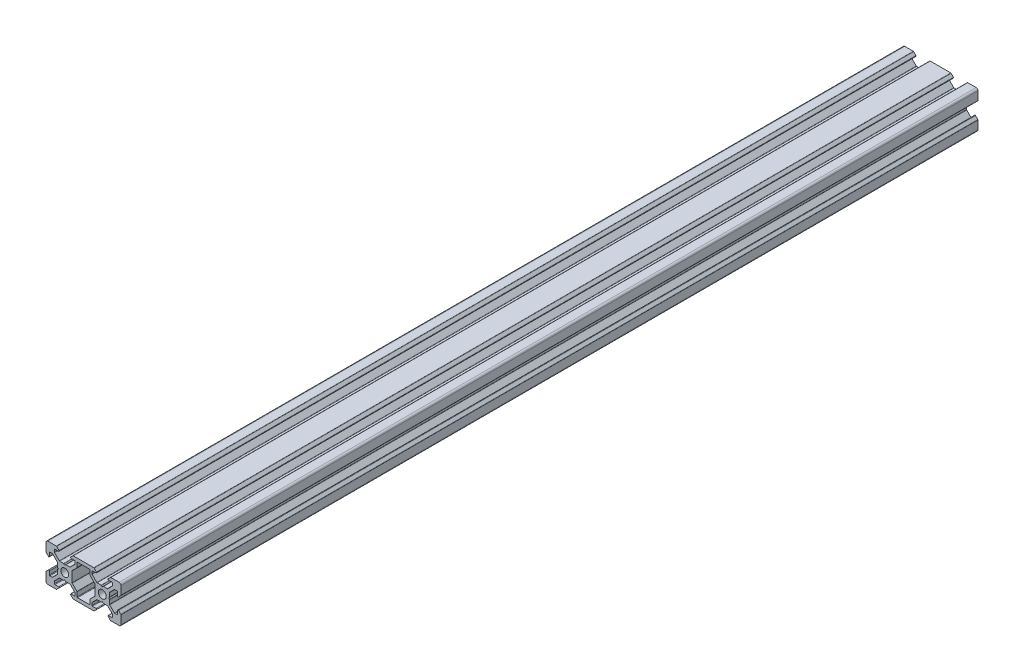
from build123d import *

# Parameters (mm, degrees)
SKETCH_1_R      = 2.1
EXTRUDE_1_DEPTH = 457
FILLET_1_R      = 1
FILLET_2_R      = 0.3


with BuildPart() as part:
    # Эскиз1 → Бобышка-Вытянуть1 (new body)
    with BuildSketch(Plane.XY):
        Polygon((-10, -10), (-10, -4.4), (-8.2, -2.6), (-8.2, -5.499339828), (-6.56, -5.499339828), (-3.900660172, -2.84), (-3.900660172, -0.5), (-3.400660172, 0), (-3.900660172, 0.5), (-3.900660172, 2.84), (-6.56, 5.499339828), (-8.2, 5.499339828), (-8.2, 2.6), (-10, 4.4), (-10, 10), (-4.4, 10), (-2.6, 8.2), (-5.499339828, 8.2), (-5.499339828, 6.56), (-2.84, 3.900660172), (-0.5, 3.900660172), (0, 3.400660172), (0.5, 3.900660172), (2.84, 3.900660172), (5.499339828, 6.56), (5.499339828, 8.2), (2.6, 8.2), (4.4, 10), (15.6, 10), (17.4, 8.2), (14.500660172, 8.2), (14.500660172, 6.56), (17.16, 3.900660172), (19.5, 3.900660172), (20, 3.400660172), (20.5, 3.900660172), (22.84, 3.900660172), (25.499339828, 6.56), (25.499339828, 8.2), (22.6, 8.2), (24.4, 10), (30, 10), (30, 4.4), (28.2, 2.6), (28.2, 5.499339828), (26.56, 5.499339828), (23.900660172, 2.84), (23.900660172, 0.5), (23.400660172, 0), (23.900660172, -0.5), (23.900660172, -2.84), (26.56, -5.499339828), (28.2, -5.499339828), (28.2, -2.6), (30, -4.4), (30, -10), (24.4, -10), (22.6, -8.2), (25.499339828, -8.2), (25.499339828, -6.56), (22.84, -3.900660172), (20.5, -3.900660172), (20, -3.400660172), (19.5, -3.900660172), (17.16, -3.900660172), (14.500660172, -6.56), (14.500660172, -8.2), (17.4, -8.2), (15.6, -10), (4.4, -10), (2.6, -8.2), (5.499339828, -8.2), (5.499339828, -6.56), (2.84, -3.900660172), (0.5, -3.900660172), (0, -3.400660172), (-0.5, -3.900660172), (-2.84, -3.900660172), (-5.499339828, -6.56), (-5.499339828, -8.2), (-2.6, -8.2), (-4.4, -10), align=None)
        Circle(SKETCH_1_R, mode=Mode.SUBTRACT)
        with Locations((20, 0)):
            Circle(SKETCH_1_R, mode=Mode.SUBTRACT)
        Polygon((3.900660172, -0.5), (3.900660172, 0.5), (3.900660172, 2.84), (6.56, 5.499339828), (6.56, 8.2), (13.44, 8.2), (13.44, 5.499339828), (16.099339828, 2.84), (16.099339828, 0.5), (16.099339828, -0.5), (16.099339828, -2.84), (13.44, -5.499339828), (13.44, -8.2), (6.56, -8.2), (6.56, -5.499339828), (3.900660172, -2.84), align=None, mode=Mode.SUBTRACT)
    extrude(amount=EXTRUDE_1_DEPTH)

    # Скругление1
    fillet_1_edges = [part.edges().sort_by_distance(p)[0] for p in [
        (-10, 10, 228.5),
        (-10, -10, 228.5),
        (30, 10, 228.5),
        (30, -10, 228.5),
    ]]
    fillet(fillet_1_edges, radius=FILLET_1_R)

    # Скругление2
    fillet_2_edges = [part.edges().sort_by_distance(p)[0] for p in [
        (-4.4, 10, 228.5),
        (-2.6, 8.2, 228.5),
        (-5.499339828, 8.2, 228.5),
        (-5.499339828, 6.56, 228.5),
        (-2.84, 3.900660172, 228.5),
        (-0.5, 3.900660172, 228.5),
        (0.5, 3.900660172, 228.5),
        (2.84, 3.900660172, 228.5),
        (5.499339828, 6.56, 228.5),
        (4.4, 10, 228.5),
        (5.499339828, 8.2, 228.5),
        (2.6, 8.2, 228.5),
        (3.900660172, 2.84, 228.5),
        (3.900660172, -2.84, 228.5),
        (4.4, -10, 228.5),
        (2.6, -8.2, 228.5),
        (5.499339828, -8.2, 228.5),
        (5.499339828, -6.56, 228.5),
        (2.84, -3.900660172, 228.5),
        (0.5, -3.900660172, 228.5),
        (-0.5, -3.900660172, 228.5),
        (-2.84, -3.900660172, 228.5),
        (-5.499339828, -6.56, 228.5),
        (-5.499339828, -8.2, 228.5),
        (-2.6, -8.2, 228.5),
        (-10, -4.4, 228.5),
        (-8.2, -2.6, 228.5),
        (-8.2, -5.499339828, 228.5),
        (-6.56, -5.499339828, 228.5),
        (-3.900660172, -2.84, 228.5),
        (-3.900660172, -0.5, 228.5),
        (-3.900660172, 0.5, 228.5),
        (-3.900660172, 2.84, 228.5),
        (-6.56, 5.499339828, 228.5),
        (-8.2, 5.499339828, 228.5),
        (-8.2, 2.6, 228.5),
        (-10, 4.4, 228.5),
        (6.56, -5.499339828, 228.5),
        (6.56, 5.499339828, 228.5),
        (6.56, 8.2, 228.5),
        (13.44, 8.2, 228.5),
        (13.44, 5.499339828, 228.5),
        (16.099339828, 2.84, 228.5),
        (16.099339828, -2.84, 228.5),
        (13.44, -5.499339828, 228.5),
        (13.44, -8.2, 228.5),
        (6.56, -8.2, 228.5),
        (15.6, 10, 228.5),
        (17.4, 8.2, 228.5),
        (14.500660172, 8.2, 228.5),
        (14.500660172, 6.56, 228.5),
        (17.16, 3.900660172, 228.5),
        (19.5, 3.900660172, 228.5),
        (20.5, 3.900660172, 228.5),
        (22.84, 3.900660172, 228.5),
        (25.499339828, 6.56, 228.5),
        (25.499339828, 8.2, 228.5),
        (22.6, 8.2, 228.5),
        (24.4, 10, 228.5),
        (30, 4.4, 228.5),
        (28.2, 2.6, 228.5),
        (28.2, 5.499339828, 228.5),
        (26.56, 5.499339828, 228.5),
        (23.900660172, 2.84, 228.5),
        (23.900660172, 0.5, 228.5),
        (23.900660172, -0.5, 228.5),
        (23.900660172, -2.84, 228.5),
        (26.56, -5.499339828, 228.5),
        (28.2, -5.499339828, 228.5),
        (28.2, -2.6, 228.5),
        (30, -4.4, 228.5),
        (24.4, -10, 228.5),
        (22.6, -8.2, 228.5),
        (25.499339828, -8.2, 228.5),
        (25.499339828, -6.56, 228.5),
        (22.84, -3.900660172, 228.5),
        (20.5, -3.900660172, 228.5),
        (19.5, -3.900660172, 228.5),
        (17.16, -3.900660172, 228.5),
        (14.500660172, -6.56, 228.5),
        (14.500660172, -8.2, 228.5),
        (17.4, -8.2, 228.5),
        (15.6, -10, 228.5),
    ]]
    fillet(fillet_2_edges, radius=FILLET_2_R)


solid = part.part
